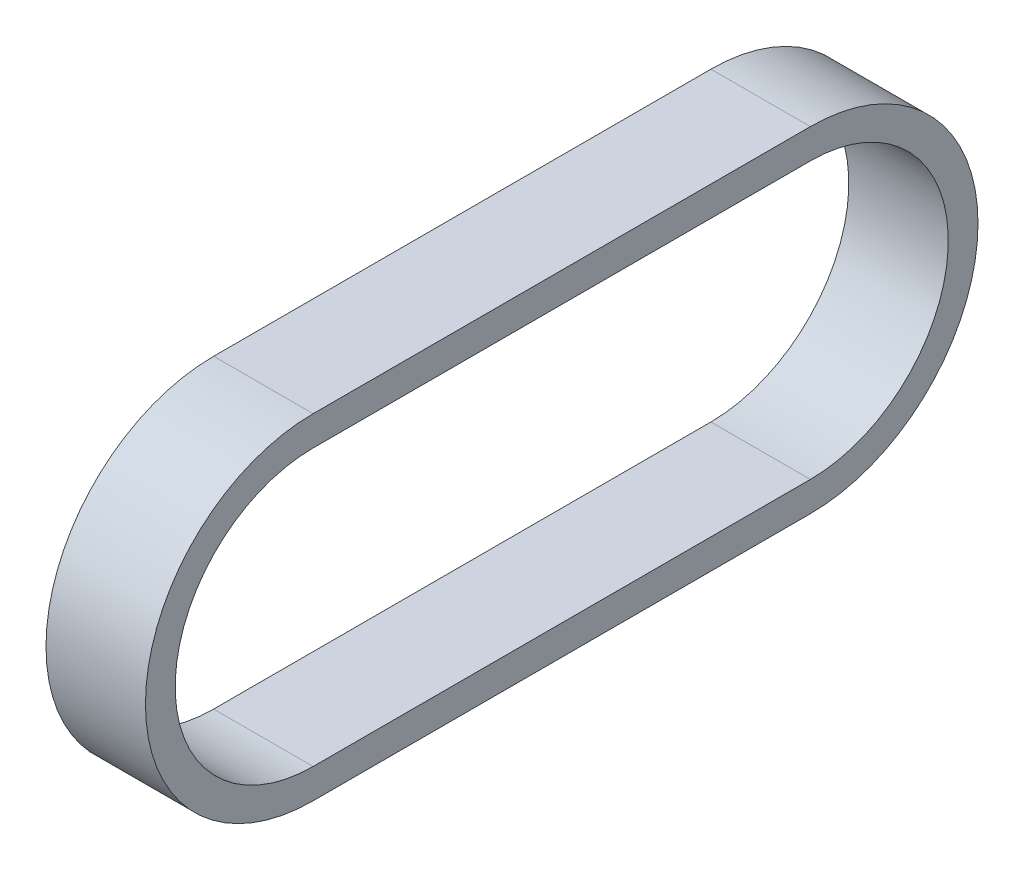
from build123d import *

# Parameters (mm, degrees)
EXTRUDE_THIN1_DEPTH = 8.5


with BuildPart() as part:
    # Sketch1 → Extrude-Thin1 (new body)
    with BuildSketch(Plane(origin=(0, 0, 0), x_dir=(0, 0, -1), z_dir=(1, 0, 0))):
        with BuildLine():
            Line((21.2471, -14.3256), (-21.2471, -14.3256))
            ThreePointArc((-21.2471, -14.3256), (-35.5727, 0), (-21.2471, 14.3256))
            Line((-21.2471, 14.3256), (21.2471, 14.3256))
            ThreePointArc((21.2471, 14.3256), (35.5727, 0), (21.2471, -14.3256))
        make_face()
        with BuildLine():
            Line((21.2471, -11.7856), (-21.2471, -11.7856))
            ThreePointArc((-21.2471, -11.7856), (-33.0327, 0), (-21.2471, 11.7856))
            Line((-21.2471, 11.7856), (21.2471, 11.7856))
            ThreePointArc((21.2471, 11.7856), (33.0327, 0), (21.2471, -11.7856))
        make_face(mode=Mode.SUBTRACT)
    extrude(amount=EXTRUDE_THIN1_DEPTH)


solid = part.part
